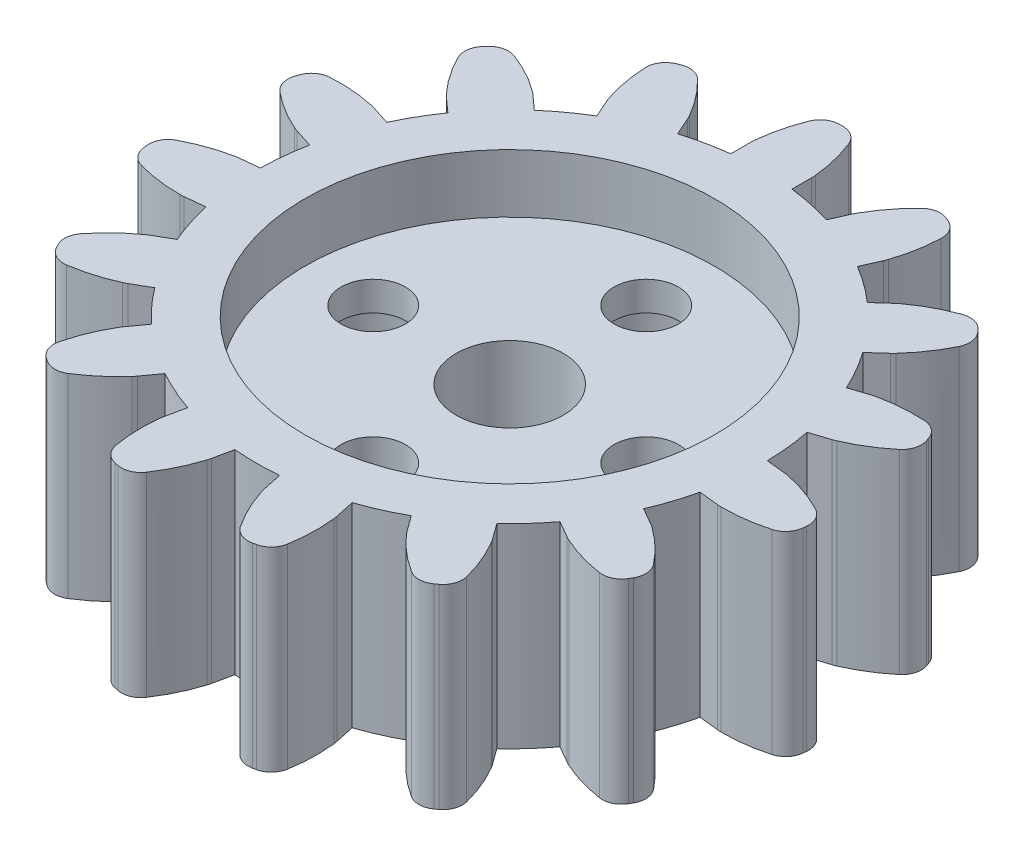
from build123d import *

# Parameters (mm, degrees)
BOSS_EXTRU_2_DEPTH                 = 10
CONG_1_R                           = 1
CONG_2_R                           = 2
R_P_TITION_CIRCULAIRE1_COUNT       = 15
CONG_1_OF_R_P_TITION_CIRCULAIRE1_R = 1
CONG_2_OF_R_P_TITION_CIRCULAIRE1_R = 2
ESQUISSE2_R                        = 10.5
ENL_V_MAT_EXTRU_1_DEPTH            = 3
ESQUISSE3_R                        = 2.75
ESQUISSE3_R_2                      = 1.65
ENL_V_MAT_EXTRU_2_DEPTH            = 25.986354098
ESQUISSE4_R                        = 2.75
ENL_V_MAT_EXTRU_3_DEPTH            = 5.5


with BuildPart() as part:
    # Esquisse1 → Boss.-Extru.2 (new body)
    with BuildSketch(Plane(origin=(0, 0, 0), x_dir=(1, 0, 0), z_dir=(0, 1, 0))):
        with BuildLine():
            add(Edge.make_bspline(
                [(0.74, 16.983886481), (1.439264481, 15.563412357), (1.57, 14.007288281)],
                knots=[0, 0, 0, 1, 1, 1], degree=2))
            Line((1.57, 14.007288281), (1.57, 12.904847926))
            ThreePointArc((1.57, 12.904847926), (2.138513401, 12.822899845), (2.702851981, 12.71591881))
            Line((2.702851981, 12.71591881), (0, 0))
            Line((0, 0), (-2.702851981, 12.71591881))
            ThreePointArc((-2.702851981, 12.71591881), (-2.138513401, 12.822899845), (-1.57, 12.904847926))
            Line((-1.57, 12.904847926), (-1.57, 14.007288281))
            add(Edge.make_bspline(
                [(-0.74, 16.983886481), (-1.439264481, 15.563412357), (-1.57, 14.007288281)],
                knots=[0, 0, 0, 1, 1, 1], degree=2))
            ThreePointArc((-0.74, 16.983886481), (0, 17), (0.74, 16.983886481))
        make_face()
    boss_extru_2 = extrude(amount=BOSS_EXTRU_2_DEPTH)

    # Congé1
    cong_1_edges = [part.edges().sort_by_distance(p)[0] for p in [
        (0.74, 5, -16.983886481),
        (-0.74, 5, -16.983886481),
    ]]
    fillet(cong_1_edges, radius=CONG_1_R)

    # Congé2
    # the kernel refuses this fillet: 2 mm, written as the material it takes off along each edge
    with BuildSketch(Plane(origin=(1.57, -0.256438353, -14.007288281), x_dir=(-0.08978362866717826, 0, -0.9959612944403784), z_dir=(0, 1, 0))) as cong_2_piece_1:
        with BuildLine():
            CenterArc((0.090377898, 1.999962805), CONG_2_R, 264.848840467, 5.500592703)
            Line((-0.089189359, 0.008040216), (0, 0))
            ThreePointArc((0, 0), (0.05128767, -0.000156259), (0.102575341, 0))
        make_face()
    extrude(amount=10.512876706, mode=Mode.SUBTRACT)
    with BuildSketch(Plane(origin=(-1.57, -0.256438353, -14.007288281), x_dir=(0.08978362866717826, 0, -0.9959612944403784), z_dir=(0, 1, 0))) as cong_2_piece_2:
        with BuildLine():
            CenterArc((0.090377898, -1.999962805), CONG_2_R, 89.650566831, 5.500592703)
            Line((-0.089189359, -0.008040216), (0, 0))
            ThreePointArc((0, 0), (0.05128767, 0.000156259), (0.102575341, 0))
        make_face()
    extrude(amount=10.512876706, mode=Mode.SUBTRACT)

    # Répétition circulaire1: Boss.-Extru.2 ×15 about axis
    r_p_tition_circulaire1_axis = Axis((0, 10, 0), (0, -1, 0))
    for i in range(1, R_P_TITION_CIRCULAIRE1_COUNT):
        add(boss_extru_2.rotate(r_p_tition_circulaire1_axis, i * 360 / R_P_TITION_CIRCULAIRE1_COUNT))

    # Congé1 of Répétition circulaire1
    cong_1_of_r_p_tition_circulaire1_edges = [part.edges().sort_by_distance(p)[0] for p in [
        (7.583992612, 5, -15.214567232),
        (6.231945335, 5, -15.816537464),
        (13.116644004, 5, -10.814511089),
        (12.126330706, 5, -11.91436543),
        (16.381308486, 5, -4.544527731),
        (15.923963334, 5, -5.952091375),
        (16.813495911, 5, 2.511245757),
        (16.968198037, 5, 1.039353352),
        (14.338477148, 5, 9.132802039),
        (15.078477148, 5, 7.851084442),
        (9.384205424, 5, 14.17521388),
        (10.581550576, 5, 13.305291707),
        (2.80731933, 5, 16.766602464),
        (4.254977779, 5, 16.458893161),
        (-4.254977779, 5, 16.458893161),
        (-2.80731933, 5, 16.766602464),
        (-10.581550576, 5, 13.305291707),
        (-9.384205424, 5, 14.17521388),
        (-15.078477148, 5, 7.851084442),
        (-14.338477148, 5, 9.132802039),
        (-16.968198037, 5, 1.039353352),
        (-16.813495911, 5, 2.511245757),
        (-15.923963334, 5, -5.952091375),
        (-16.381308486, 5, -4.544527731),
        (-12.126330706, 5, -11.91436543),
        (-13.116644004, 5, -10.814511089),
        (-6.231945335, 5, -15.816537464),
        (-7.583992612, 5, -15.214567232),
    ]]
    fillet(cong_1_of_r_p_tition_circulaire1_edges, radius=CONG_1_OF_R_P_TITION_CIRCULAIRE1_R)

    # Congé2 of Répétition circulaire1
    # the kernel refuses this fillet: 2 mm, written as the material it takes off along each edge
    with BuildSketch(Plane(origin=(7.131543783, -0.256438353, -12.157718054), x_dir=(0.3230725273945345, 0, -0.9463742082511061), z_dir=(0, 1, 0)), Plane(origin=(11.459978857, -0.256438353, -8.205967925), x_dir=(0.6800665084479693, 0, -0.733150423915439), z_dir=(0, 1, 0)), Plane(origin=(13.806879477, -0.256438353, -2.835331393), x_dir=(0.9194708119804667, 0, -0.3931582708223005), z_dir=(0, 1, 0)), Plane(origin=(13.766445203, -0.256438353, 3.025559694), x_dir=(0.9998902589914579, 0, 0.01481451902678982), z_dir=(0, 1, 0)), Plane(origin=(11.34566749, -0.256438353, 8.363304025), x_dir=(0.9074195965049895, 0, 0.42022574395046547), z_dir=(0, 1, 0)), Plane(origin=(6.963120795, -0.256438353, 12.254957111), x_dir=(0.6580478421345721, 0, 0.7529761201140667), z_dir=(0, 1, 0)), Plane(origin=(1.376587257, -0.256438353, 14.02761678), x_dir=(0.2948936376821204, 0, 0.9555300845366441), z_dir=(0, 1, 0)), Plane(origin=(-4.447970724, -0.256438353, 13.374774071), x_dir=(-0.1192503557501645, 0, 0.9928642166245389), z_dir=(0, 1, 0)), Plane(origin=(-4.263011046, -0.256438353, -13.434871113), x_dir=(-0.4871153796736853, 0, -0.8733376247965968), z_dir=(0, 1, 0))) as cong_2_of_r_p_tition_circulaire1_piece_1:
        with BuildLine():
            CenterArc((0.090377898, 1.999962805), CONG_2_OF_R_P_TITION_CIRCULAIRE1_R, 264.848840467, 5.500592703)
            Line((-0.089189359, 0.008040216), (0, 0))
            ThreePointArc((0, 0), (0.05128767, -0.000156259), (0.102575341, 0))
        make_face()
    extrude(amount=10.512876706, mode=Mode.SUBTRACT)
    with BuildSketch(Plane(origin=(4.263011046, -0.256438353, -13.434871113), x_dir=(0.4871153796736772, 0, -0.8733376247966015), z_dir=(0, 1, 0)), Plane(origin=(-6.963120795, -0.256438353, 12.254957111), x_dir=(-0.6580478421345879, 0, 0.7529761201140528), z_dir=(0, 1, 0)), Plane(origin=(-11.34566749, -0.256438353, 8.363304025), x_dir=(-0.9074195965049896, 0, 0.42022574395046514), z_dir=(0, 1, 0)), Plane(origin=(-13.766445203, -0.256438353, 3.025559694), x_dir=(-0.9998902589914579, 0, 0.014814519026788795), z_dir=(0, 1, 0)), Plane(origin=(-13.806879477, -0.256438353, -2.835331393), x_dir=(-0.9194708119804682, 0, -0.3931582708222968), z_dir=(0, 1, 0)), Plane(origin=(-11.459978857, -0.256438353, -8.205967925), x_dir=(-0.680066508447966, 0, -0.733150423915442), z_dir=(0, 1, 0)), Plane(origin=(-7.131543783, -0.256438353, -12.157718054), x_dir=(-0.32307252739453374, 0, -0.9463742082511062), z_dir=(0, 1, 0))) as cong_2_of_r_p_tition_circulaire1_piece_2:
        with BuildLine():
            CenterArc((0.090377898, -1.999962805), CONG_2_OF_R_P_TITION_CIRCULAIRE1_R, 89.650566831, 5.500592703)
            Line((-0.089189359, -0.008040216), (0, 0))
            ThreePointArc((0, 0), (0.05128767, 0.000156259), (0.102575341, 0))
        make_face()
    extrude(amount=10.512876706, mode=Mode.SUBTRACT)
    with BuildSketch(Plane(origin=(9.358908753, -0.256438353, -10.539442677), x_dir=(-0.7431448254773954, 0, 0.6691306063588571), z_dir=(0, 1, 0)), Plane(origin=(12.836566115, -0.256438353, -5.821648855), x_dir=(-0.9510565162951546, 0, 0.3090169943749442), z_dir=(0, 1, 0)), Plane(origin=(14.094664578, -0.256438353, -0.097239057), x_dir=(-0.9945218953682733, 0, -0.10452846326765383), z_dir=(0, 1, 0)), Plane(origin=(12.91566749, -0.256438353, 5.643984257), x_dir=(-0.8660254037844374, 0, -0.5000000000000024), z_dir=(0, 1, 0)), Plane(origin=(9.503434158, -0.256438353, 10.409311419), x_dir=(-0.5877852522924663, 0, -0.8090169943749524), z_dir=(0, 1, 0)), Plane(origin=(4.447970724, -0.256438353, 13.374774071), x_dir=(-0.20791169081776417, 0, -0.9781476007338047), z_dir=(0, 1, 0)), Plane(origin=(-1.376587257, -0.256438353, 14.02761678), x_dir=(0.20791169081775848, 0, -0.9781476007338058), z_dir=(0, 1, 0))) as cong_2_of_r_p_tition_circulaire1_piece_3:
        with BuildLine():
            CenterArc((0.089551029, 2), CONG_2_OF_R_P_TITION_CIRCULAIRE1_R, 264.499407297, 5.500592703)
            ThreePointArc((-0.10216107, 0.009209586), (-0.051094564, 0.004449165), (0, 0))
            Line((0, 0), (0.089551029, 0))
        make_face()
    extrude(amount=10.512876706, mode=Mode.SUBTRACT)
    with BuildSketch(Plane(origin=(-9.503434158, -0.256438353, 10.409311419), x_dir=(0.5877852522924757, 0, -0.8090169943749456), z_dir=(0, 1, 0)), Plane(origin=(-12.91566749, -0.256438353, 5.643984257), x_dir=(0.866025403784439, 0, -0.49999999999999944), z_dir=(0, 1, 0)), Plane(origin=(-14.094664578, -0.256438353, -0.097239057), x_dir=(0.9945218953682733, 0, -0.10452846326765339), z_dir=(0, 1, 0)), Plane(origin=(-12.836566115, -0.256438353, -5.821648855), x_dir=(0.951056516295153, 0, 0.30901699437494906), z_dir=(0, 1, 0)), Plane(origin=(-9.358908753, -0.256438353, -10.539442677), x_dir=(0.7431448254773982, 0, 0.6691306063588538), z_dir=(0, 1, 0))) as cong_2_of_r_p_tition_circulaire1_piece_4:
        with BuildLine():
            CenterArc((0.089551029, -2), CONG_2_OF_R_P_TITION_CIRCULAIRE1_R, 90, 5.500592703)
            ThreePointArc((-0.10216107, -0.009209586), (-0.051094564, -0.004449165), (0, 0))
            Line((0, 0), (0.089551029, 0))
        make_face()
    extrude(amount=10.512876706, mode=Mode.SUBTRACT)

    # Esquisse2 → Enlèv. mat.-Extru.1 (cut)
    with BuildSketch(Plane(origin=(0, 10, 0), x_dir=(1, 0, 0), z_dir=(0, 1, 0))):
        with Locations(Location((0, 0, 0), (0, 0, 270))):
            Circle(ESQUISSE2_R)
    extrude(amount=-ENL_V_MAT_EXTRU_1_DEPTH, mode=Mode.SUBTRACT)

    # Esquisse3 → Enlèv. mat.-Extru.2 (cut, through all)
    with BuildSketch(Plane(origin=(0, 7, 0), x_dir=(1, 0, 0), z_dir=(0, 1, 0))):
        with Locations(Location((0, 0, 0), (0, 0, 270))):
            Circle(ESQUISSE3_R)
        with Locations(Location((0, 7, 0), (0, 0, 270))):
            Circle(ESQUISSE3_R_2)
        with Locations(Location((7, 0, 0), (0, 0, 270))):
            Circle(ESQUISSE3_R_2)
        with Locations(Location((0, -7, 0), (0, 0, 270))):
            Circle(ESQUISSE3_R_2)
        with Locations(Location((-7, 0, 0), (0, 0, 270))):
            Circle(ESQUISSE3_R_2)
    extrude(amount=-ENL_V_MAT_EXTRU_2_DEPTH, mode=Mode.SUBTRACT)

    # Esquisse4 → Enlèv. mat.-Extru.3 (cut)
    with BuildSketch(Plane.XZ):
        with Locations(Location((0, 7, 0), (0, 0, 270))):
            Circle(ESQUISSE4_R)
        with Locations(Location((7, 0, 0), (0, 0, 270))):
            Circle(ESQUISSE4_R)
        with Locations(Location((0, -7, 0), (0, 0, 270))):
            Circle(ESQUISSE4_R)
        with Locations(Location((-7, 0, 0), (0, 0, 270))):
            Circle(ESQUISSE4_R)
    extrude(amount=-ENL_V_MAT_EXTRU_3_DEPTH, mode=Mode.SUBTRACT)


solid = part.part
